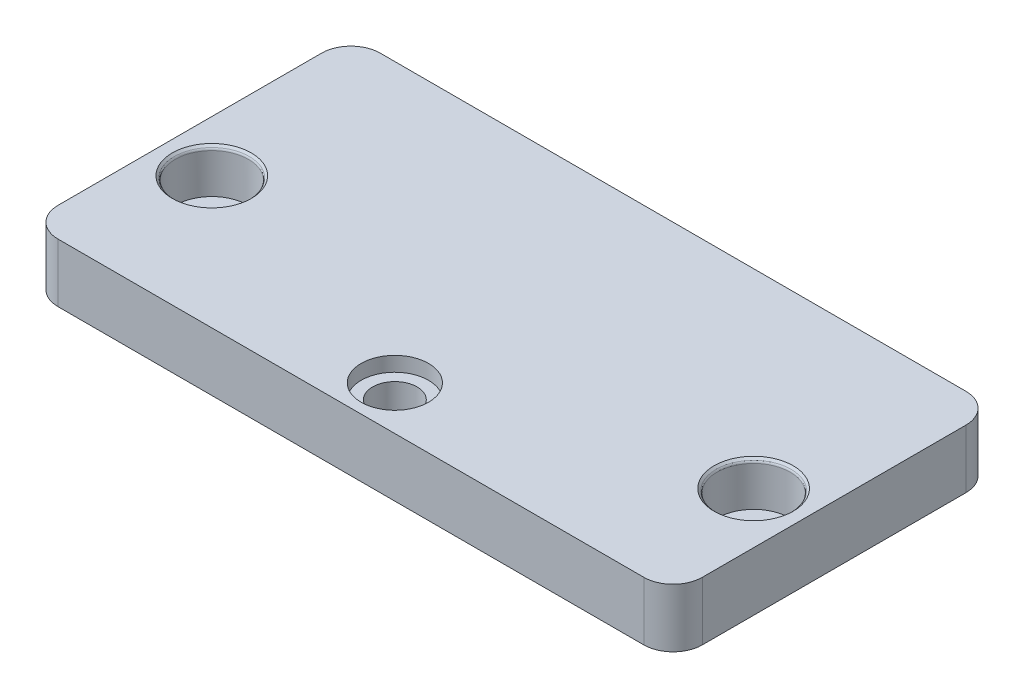
from build123d import *

# Parameters (mm, degrees)
SKETCH1_W           = 220
SKETCH1_H           = 110
BOSS_EXTRUDE1_DEPTH = 20
SKETCH2_R           = 12.49
SKETCH2_R_2         = 7.6
CUT_EXTRUDE1_DEPTH  = 15
CHAMFER1_SIZE       = 1
FILLET1_R           = 1
SKETCH4_R           = 11.5
CUT_EXTRUDE2_DEPTH  = 5
FILLET2_R           = 10


with BuildPart() as part:
    # Sketch1 → Boss-Extrude1 (new body)
    with BuildSketch(Plane(origin=(0, 0, 0), x_dir=(1, 0, 0), z_dir=(0, 1, 0))):
        with Locations((110, 55)):
            Rectangle(SKETCH1_W, SKETCH1_H)
    extrude(amount=BOSS_EXTRUDE1_DEPTH)

    # Sketch2 → Cut-Extrude1 (cut)
    with BuildSketch(Plane(origin=(0, 20, 0), x_dir=(1, 0, 0), z_dir=(0, 1, 0))):
        with Locations((17.5, 45)):
            Circle(SKETCH2_R)
        with Locations((202.5, 45)):
            Circle(SKETCH2_R)
        with Locations((110, 15)):
            Circle(SKETCH2_R_2)
    extrude(amount=-CUT_EXTRUDE1_DEPTH, mode=Mode.SUBTRACT)

    # Chamfer1
    chamfer1_edges = [part.edges().sort_by_distance(p)[0] for p in [
        (190.01, 20, -45),
        (5.01, 20, -45),
    ]]
    chamfer(chamfer1_edges, length=CHAMFER1_SIZE)

    # Fillet1
    fillet1_edges = [part.edges().sort_by_distance(p)[0] for p in [
        (190.01, 19, -45),
        (5.01, 19, -45),
    ]]
    fillet(fillet1_edges, radius=FILLET1_R)

    # Sketch4 → Cut-Extrude2 (cut)
    with BuildSketch(Plane(origin=(0, 20, 0), x_dir=(1, 0, 0), z_dir=(0, 1, 0))):
        with Locations((110, 15)):
            Circle(SKETCH4_R)
    extrude(amount=-CUT_EXTRUDE2_DEPTH, mode=Mode.SUBTRACT)

    # Fillet2
    fillet2_edges = [part.edges().sort_by_distance(p)[0] for p in [
        (220, 10, -110),
        (220, 10, 0),
        (0, 10, 0),
        (0, 10, -110),
    ]]
    fillet(fillet2_edges, radius=FILLET2_R)


solid = part.part
